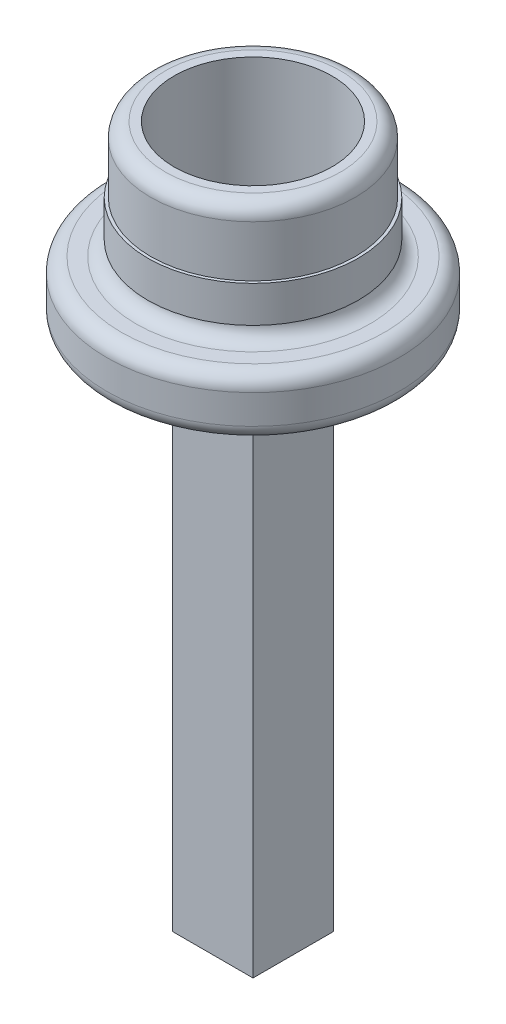
from build123d import *

# Parameters (mm, degrees)
SKETCH2_R           = 25
BOSS_EXTRUDE1_DEPTH = 10
SKETCH3_R           = 17.5
BOSS_EXTRUDE3_DEPTH = 20
SKETCH4_R           = 13.5
CUT_EXTRUDE1_DEPTH  = 25
SKETCH5_W           = 13.75
SKETCH5_H           = 13.75
BOSS_EXTRUDE4_DEPTH = 100
FILLET2_R           = 2.5
FILLET3_R           = 2.5
WRAP1_START         = 12.5
WRAP1_OUTLINE_R     = 18
WRAP1_OUTLINE_R_2   = 17.5
WRAP1_DEPTH         = 6.23469337
SKETCH8_W           = 13.75
SKETCH8_H           = 13.75
CUT_EXTRUDE2_DEPTH  = 5
SKETCH8_2_W         = 13.75
SKETCH8_2_H         = 13.75
CUT_EXTRUDE3_DEPTH  = 10
SCALE1_SCALE        = 0.8


# Read off the part's stored shape, not the designer's step: Wrap1
with BuildPart() as part:
    # Sketch2 → Boss-Extrude1 (new body)
    with BuildSketch(Plane(origin=(0, 0, 0), x_dir=(1, 0, 0), z_dir=(0, 1, 0))):
        with Locations(Location((0, 0, 0), (0, 0, 270))):
            Circle(SKETCH2_R)
    extrude(amount=BOSS_EXTRUDE1_DEPTH)

    # Sketch3 → Boss-Extrude3 (add)
    with BuildSketch(Plane(origin=(0, 10, 0), x_dir=(1, 0, 0), z_dir=(0, 1, 0))):
        with Locations(Location((0, 0, 0), (0, 0, 270))):
            Circle(SKETCH3_R)
    extrude(amount=BOSS_EXTRUDE3_DEPTH)

    # Sketch4 → Cut-Extrude1 (cut)
    with BuildSketch(Plane(origin=(0, 30, 0), x_dir=(1, 0, 0), z_dir=(0, 1, 0))):
        with Locations(Location((0, 0, 0), (0, 0, 270))):
            Circle(SKETCH4_R)
    extrude(amount=-CUT_EXTRUDE1_DEPTH, mode=Mode.SUBTRACT)

    # Sketch5 → Boss-Extrude4 (add)
    with BuildSketch(Plane.XZ):
        Rectangle(SKETCH5_W, SKETCH5_H)
    extrude(amount=BOSS_EXTRUDE4_DEPTH)

    # Fillet2
    fillet2_edges = [part.edges().sort_by_distance(p)[0] for p in [
        (0, 0, -25),
        (0, 10, -25),
        (0, 10, -17.5),
    ]]
    fillet(fillet2_edges, radius=FILLET2_R)

    # Fillet3
    fillet3_edges = [part.edges().sort_by_distance(p)[0] for p in [
        (0, 30, -17.5),
    ]]
    fillet(fillet3_edges, radius=FILLET3_R)

    # Wrap1 outline → Wrap1 (add)
    with BuildSketch(Plane(origin=(0, 0, 0), x_dir=(1, 0, 0), z_dir=(0, 1, 0)).offset(WRAP1_START)):
        Circle(WRAP1_OUTLINE_R)
        Circle(WRAP1_OUTLINE_R_2, mode=Mode.SUBTRACT)
    extrude(amount=WRAP1_DEPTH)

    # Sketch8 → Cut-Extrude2 (cut)
    with BuildSketch(Plane.XZ.offset(100)):
        Rectangle(SKETCH8_W, SKETCH8_H)
    extrude(amount=-CUT_EXTRUDE2_DEPTH, mode=Mode.SUBTRACT)

    # Sketch8<2> → Cut-Extrude3 (cut)
    with BuildSketch(Plane.XZ.offset(100)):
        Rectangle(SKETCH8_2_W, SKETCH8_2_H)
    extrude(amount=-CUT_EXTRUDE3_DEPTH, mode=Mode.SUBTRACT)


with BuildPart() as part_1:
    # Scale1: scaled about (0, -12.821549585, 0)
    add(part.part.scale(SCALE1_SCALE).moved(Location((0, -2.564309917, 0))))


solid = part_1.part
